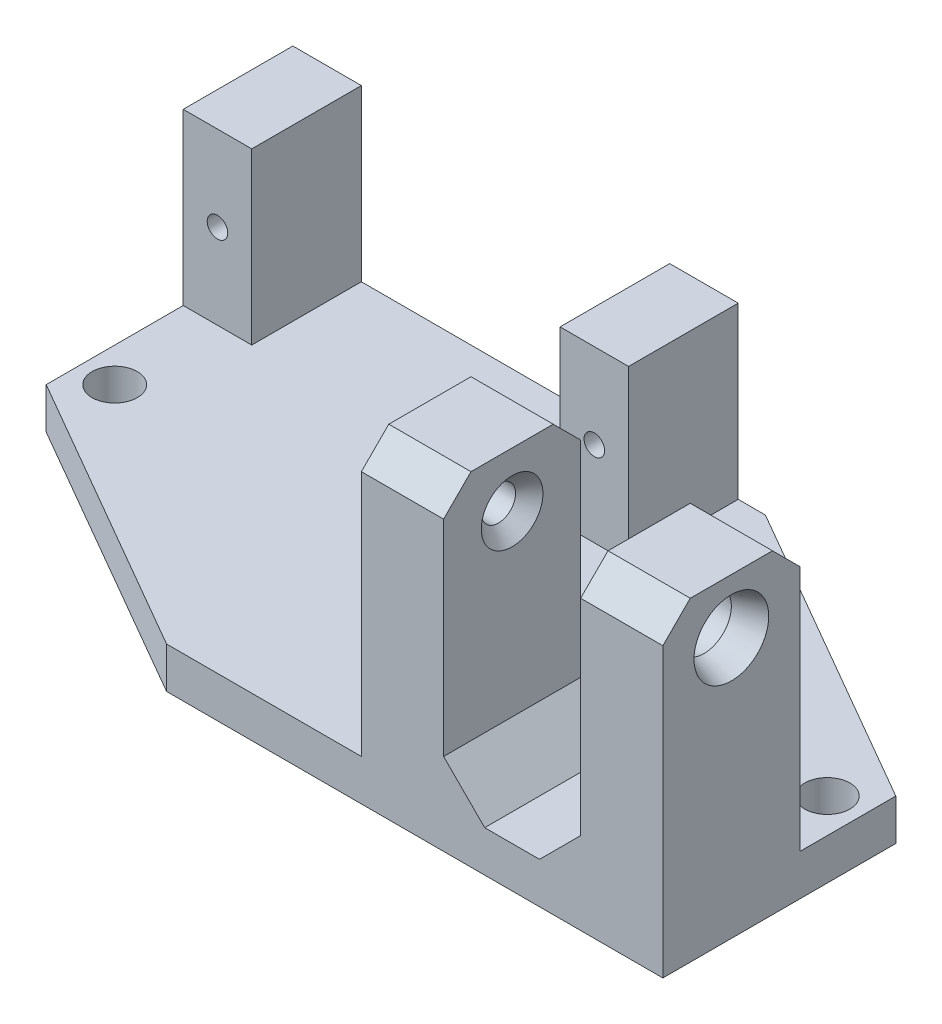
from build123d import *

# Parameters (mm, degrees)
SKETCH1_W                  = 57
SKETCH1_H                  = 37
BOSS_EXTRUDE1_DEPTH        = 3
SKETCH2_W                  = 5
SKETCH2_H                  = 8
BOSS_EXTRUDE2_DEPTH        = 12.4
F_1_5_1_5_DIAMETER_HOLE1_D = 1.5
SKETCH6_W                  = 6
SKETCH6_H                  = 10
BOSS_EXTRUDE3_DEPTH        = 20
CUT_EXTRUDE1_REACH         = 66.189
SKETCH7_R                  = 2
CHAMFER2_SIZE              = 2
CHAMFER2_SIZE2             = 0.727940469
CHAMFER3_SIZE              = 20
CHAMFER3_SIZE2             = 34.641016151
CHAMFER4_SIZE              = 12
CHAMFER4_SIZE2             = 20.784609691
F_3_3_3_3_DIAMETER_HOLE1_D = 3.3
CHAMFER5_SIZE              = 3
SKETCH12_W                 = 34.483339502
SKETCH12_H                 = 7
CUT_EXTRUDE4_DEPTH         = 10
CHAMFER6_SIZE              = 2
CUT_EXTRUDE5_REACH         = 47.785
SKETCH13_R                 = 1.25
CHAMFER7_SIZE              = 1


with BuildPart() as part:
    # Sketch1 → Boss-Extrude1 (new body)
    with BuildSketch(Plane(origin=(0, 0, 0), x_dir=(1, 0, 0), z_dir=(0, 1, 0))):
        Rectangle(SKETCH1_W, SKETCH1_H)
    extrude(amount=BOSS_EXTRUDE1_DEPTH)

    # Sketch2 → Boss-Extrude2 (add)
    with BuildSketch(Plane(origin=(0, 3, 0), x_dir=(1, 0, 0), z_dir=(0, 1, 0))):
        with Locations((-26, 7.5)):
            Rectangle(SKETCH2_W, SKETCH2_H)
        with Locations((1.5, 7.5)):
            Rectangle(SKETCH2_W, SKETCH2_H)
    extrude(amount=BOSS_EXTRUDE2_DEPTH)

    # Ø1.5 (1.5) Diameter Hole1 (through all)
    with Locations(Plane.XY.offset(-3.5)):
        with Locations((1.5, 9.2), (-26, 9.2)):
            Hole(F_1_5_1_5_DIAMETER_HOLE1_D / 2)

    # Sketch6 → Boss-Extrude3 (add)
    with BuildSketch(Plane(origin=(0, 3, 0), x_dir=(1, 0, 0), z_dir=(0, 1, 0))):
        with Locations((25.5, -13.5)):
            Rectangle(SKETCH6_W, SKETCH6_H)
        with Locations((9.5, -13.5)):
            Rectangle(SKETCH6_W, SKETCH6_H)
    extrude(amount=BOSS_EXTRUDE3_DEPTH)

    # Sketch7 → Cut-Extrude1 (cut, up to next)
    with BuildSketch(Plane(origin=(28.5, 0, 0), x_dir=(0, 0, -1), z_dir=(1, 0, 0)), mode=Mode.PRIVATE) as cut_extrude1_sk1:
        with Locations((-13.5, 19)):
            Circle(SKETCH7_R)
    cut_extrude1_tool1 = extrude(cut_extrude1_sk1.sketch, amount=-CUT_EXTRUDE1_REACH, mode=Mode.PRIVATE) & part.part
    add(cut_extrude1_tool1.solids().sort_by_distance((28.5, 19, 13.5))[0], mode=Mode.SUBTRACT)

    # Chamfer2
    chamfer2_edges = [part.edges().sort_by_distance(p)[0] for p in [
        (22.5, 19, 15.5),
        (28.5, 19, 15.5),
    ]]
    chamfer2_side = [part.faces().sort_by_distance(p)[0] for p in [
        (25.5, 19, 15.5),
    ]]
    chamfer(chamfer2_edges, length=CHAMFER2_SIZE, length2=CHAMFER2_SIZE2, reference=chamfer2_side[0])

    # Chamfer3
    chamfer3_edges = [part.edges().sort_by_distance(p)[0] for p in [
        (28.5, 1.5, -18.5),
    ]]
    chamfer3_side = [part.faces().sort_by_distance(p)[0] for p in [
        (28.5, 19, 16.663600887),
    ]]
    chamfer(chamfer3_edges, length=CHAMFER3_SIZE, length2=CHAMFER3_SIZE2, reference=chamfer3_side[0])

    # Chamfer4
    chamfer4_edges = [part.edges().sort_by_distance(p)[0] for p in [
        (-28.5, 1.5, 18.5),
    ]]
    chamfer4_side = [part.faces().sort_by_distance(p)[0] for p in [
        (-28.5, 5.133872502, -3.539486204),
    ]]
    chamfer(chamfer4_edges, length=CHAMFER4_SIZE, length2=CHAMFER4_SIZE2, reference=chamfer4_side[0])

    # Ø3.3 (3.3) Diameter Hole1 (through all)
    with Locations(Plane(origin=(0, 3, 0), x_dir=(1, 0, 0), z_dir=(0, 1, 0))):
        with Locations((26, -4), (-26, -4)):
            Hole(F_3_3_3_3_DIAMETER_HOLE1_D / 2)

    # Chamfer5
    chamfer5_edges = [part.edges().sort_by_distance(p)[0] for p in [
        (22.5, 3, 13.5),
        (12.5, 3, 13.5),
    ]]
    chamfer(chamfer5_edges, length=CHAMFER5_SIZE)

    # Sketch12 → Cut-Extrude4 (cut)
    with BuildSketch(Plane(origin=(0, 3, 0), x_dir=(1, 0, 0), z_dir=(0, 1, 0))):
        with Locations((-11.258330249, 15)):
            Rectangle(SKETCH12_W, SKETCH12_H)
    extrude(amount=-CUT_EXTRUDE4_DEPTH, mode=Mode.SUBTRACT)

    # Chamfer6
    chamfer6_edges = [part.edges().sort_by_distance(p)[0] for p in [
        (25.5, 23, 18.5),
        (25.5, 23, 8.5),
        (9.5, 23, 8.5),
        (9.5, 23, 18.5),
    ]]
    chamfer(chamfer6_edges, length=CHAMFER6_SIZE)

    # Sketch13 → Cut-Extrude5 (cut, up to next)
    with BuildSketch(Plane.ZY.offset(-6.5), mode=Mode.PRIVATE) as cut_extrude5_sk1:
        with Locations((13.5, 19)):
            Circle(SKETCH13_R)
    cut_extrude5_tool1 = extrude(cut_extrude5_sk1.sketch, amount=-CUT_EXTRUDE5_REACH, mode=Mode.PRIVATE) & part.part
    add(cut_extrude5_tool1.solids().sort_by_distance((6.5, 19, 13.5))[0], mode=Mode.SUBTRACT)

    # Chamfer7
    chamfer7_edges = [part.edges().sort_by_distance(p)[0] for p in [
        (12.5, 19, 12.25),
        (6.5, 19, 12.25),
    ]]
    chamfer(chamfer7_edges, length=CHAMFER7_SIZE)


solid = part.part
